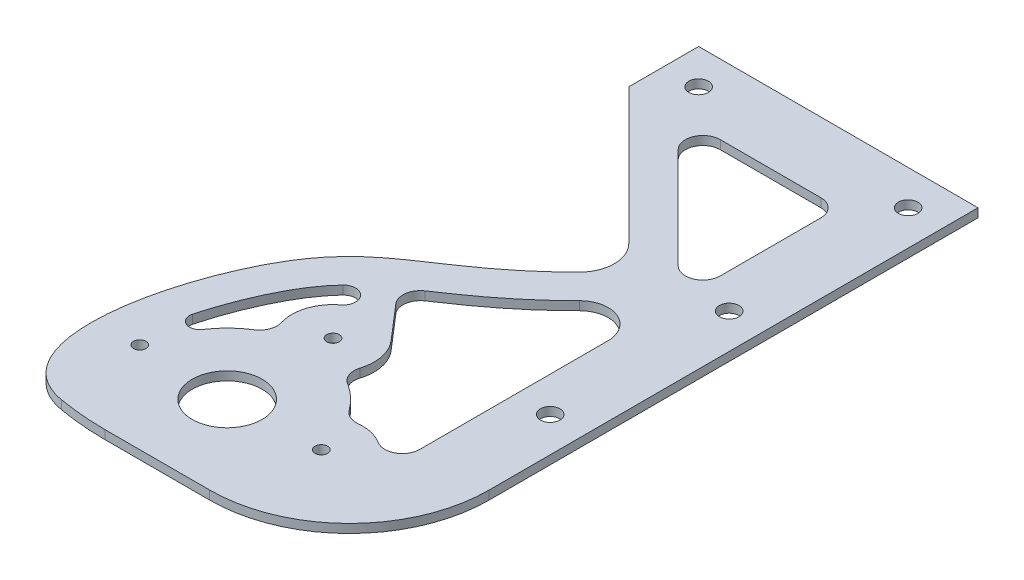
from build123d import *

# Parameters (mm, degrees)
SKETCH1_W               = 254
SKETCH1_H               = 3.175
BASE_FLANGE1_DEPTH      = 114.3
SKETCH6_R               = 12.7
CUT_EXTRUDE1_DEPTH      = 279.550840288
SKETCH7_R               = 2.286
CUT_EXTRUDE2_DEPTH      = 279.550840288
SKETCH9_R               = 3.556
CUT_EXTRUDE4_DEPTH      = 279.550840288
CUT_EXTRUDE6_DEPTH      = 279.550840288
CUT_EXTRUDE9_DEPTH      = 279.550840288
CUT_EXTRUDE9_DEPTH_BACK = 279.550840288
CUT_EXTRUDE10_DEPTH     = 221.768639368
FILLET1_R               = 50.8
CUT_EXTRUDE11_DEPTH     = 170.498049701
FILLET2_DEPTH           = 3.175


with BuildPart() as part:
    # Base-Flange1: sheet metal written as solids
    # Sketch1 → Base-Flange1 (new, symmetric)
    with BuildSketch(Plane.XY):
        with Locations((-127, 1.5875)):
            Rectangle(SKETCH1_W, SKETCH1_H)
    extrude(amount=BASE_FLANGE1_DEPTH, both=True)

    # Sketch6 → Cut-Extrude1 (cut, through all)
    with BuildSketch(Plane.XZ):
        with Locations(Location((-76.2, 82.55, 0), (0, 0, 270))):
            Circle(SKETCH6_R)
    extrude(amount=-CUT_EXTRUDE1_DEPTH, mode=Mode.SUBTRACT)

    # Sketch7 → Cut-Extrude2 (cut, through all)
    with BuildSketch(Plane.XZ):
        with Locations(Location((-43.18, 81.326566426, 0), (0, 0, 270))):
            Circle(SKETCH7_R)
        with Locations(Location((-109.22, 81.326566426, 0), (0, 0, 90))):
            Circle(SKETCH7_R)
        with Locations(Location((-76.2, 44.069, 0), (0, 0, 270))):
            Circle(SKETCH7_R)
    extrude(amount=-CUT_EXTRUDE2_DEPTH, mode=Mode.SUBTRACT)

    # Sketch9 → Cut-Extrude4 (cut, through all)
    with BuildSketch(Plane(origin=(0, 3.175, 0), x_dir=(1, 0, 0), z_dir=(0, 1, 0))):
        with Locations(Location((-12.7, 36.5125, 0), (0, 0, 180))):
            Circle(SKETCH9_R)
        with Locations((-12.7, 101.6)):
            Circle(SKETCH9_R)
        with Locations(Location((-12.7, -28.575, 0), (0, 0, 180))):
            Circle(SKETCH9_R)
        with Locations(Location((-88.9, 101.6, 0), (0, 0, 180))):
            Circle(SKETCH9_R)
    extrude(amount=-CUT_EXTRUDE4_DEPTH, mode=Mode.SUBTRACT)

    # Sketch15 → Cut-Extrude6 (cut, through all)
    with BuildSketch(Plane.XZ):
        Polygon((-101.6, -114.3), (-254, 38.1), (-254, -114.3), align=None)
    extrude(amount=-CUT_EXTRUDE6_DEPTH, mode=Mode.SUBTRACT)

    # Sketch17 → Cut-Extrude9 (cut, two sides: drawn at the far end of the back side and taken through both)
    with BuildSketch(Plane.XZ.offset(-CUT_EXTRUDE9_DEPTH_BACK)):
        with BuildLine():
            Line((-254, 114.3), (-254, 38.1))
            Line((-254, 38.1), (-159.5751337, -56.3248663))
            ThreePointArc((-159.5751337, -56.3248663), (-181.24151223, 52.599374135), (-88.9, 114.3))
            Line((-88.9, 114.3), (-254, 114.3))
        make_face()
    extrude(amount=CUT_EXTRUDE9_DEPTH + CUT_EXTRUDE9_DEPTH_BACK, mode=Mode.SUBTRACT)

    # Sketch18 → Cut-Extrude10 (cut, through all)
    with BuildSketch(Plane.XZ):
        with BuildLine():
            Line((-101.6, -114.3), (-101.6, -88.9))
            Line((-101.6, -88.9), (-52.208591334, -39.508591334))
            ThreePointArc((-52.208591334, -39.508591334), (-48.488847455, -30.528335213), (-52.208591334, -21.548079092))
            add(Edge.make_bspline(
                [(-106.256088924, 112.781538976), (-137.236150888, 107.318918188), (-113.262137977, 5.562411407), (-77.644814764, 3.888144338), (-52.208591334, -21.548079092)],
                knots=[0, 0, 0, 0, 0.537792704, 1, 1, 1, 1], degree=3))
            ThreePointArc((-106.256088924, 112.781538976), (-184.223754204, 44.405731651), (-159.5751337, -56.3248663))
            Line((-159.5751337, -56.3248663), (-101.6, -114.3))
        make_face()
    extrude(amount=-CUT_EXTRUDE10_DEPTH, mode=Mode.SUBTRACT)

    # Fillet1
    fillet1_edges = [part.edges().sort_by_distance(p)[0] for p in [
        (0, 1.5875, 114.3),
    ]]
    fillet(fillet1_edges, radius=FILLET1_R)

    # Sketch19 → Cut-Extrude11 (cut, through all)
    with BuildSketch(Plane(origin=(0, 3.175, 0), x_dir=(1, 0, 0), z_dir=(0, 1, 0))):
        with BuildLine():
            Line((-68.309231637, 88.9), (-31.75, 88.9))
            ThreePointArc((-31.75, 88.9), (-27.259871939, 87.040128061), (-25.4, 82.55))
            Line((-25.4, 82.55), (-25.4, 45.990768363))
            ThreePointArc((-25.4, 45.990768363), (-29.319960204, 40.124133332), (-36.240128061, 41.500640303))
            Line((-36.240128061, 41.500640303), (-72.799359697, 78.059871939))
            ThreePointArc((-72.799359697, 78.059871939), (-74.175866668, 84.980039796), (-68.309231637, 88.9))
        make_face()
        with BuildLine():
            Line((-25.4, 5.183084731), (-25.4, -63.31046263))
            ThreePointArc((-25.4, -63.31046263), (-28.690493445, -68.874806225), (-35.151785714, -68.672398284))
            ThreePointArc((-35.151785714, -68.672398284), (-39.759262533, -66.736201414), (-44.747192121, -66.422737896))
            ThreePointArc((-44.747192121, -66.422737896), (-47.9893887, -65.910636081), (-50.542713816, -63.847963596))
            ThreePointArc((-50.542713816, -63.847963596), (-54.493856691, -59.378771231), (-59.211239435, -55.727537129))
            ThreePointArc((-59.211239435, -55.727537129), (-61.771128872, -52.560544764), (-61.88090181, -48.489817008))
            ThreePointArc((-61.88090181, -48.489817008), (-61.530034533, -41.007577259), (-64.844174471, -34.290174786))
            Line((-64.844174471, -34.290174786), (-75.613232293, -21.784424959))
            ThreePointArc((-75.613232293, -21.784424959), (-77.094715661, -16.793975806), (-74.346704518, -12.372685217))
            add(Edge.make_bspline(
                [(-43.228335213, 12.567822971), (-46.917497652, 8.878660532), (-50.456440758, 5.648495964), (-57.219614246, -0.085464925), (-60.443504999, -2.588941631), (-66.531496779, -7.059997253), (-69.394290936, -9.027669237), (-72.834328708, -11.354789552), (-73.599593433, -11.869910022), (-74.346704518, -12.372685217)],
                knots=[0, 0, 0, 0, 0.0625, 0.0625, 0.125, 0.125, 0.1875, 0.1875, 0.205929014, 0.205929014, 0.205929014, 0.205929014], degree=3))
            ThreePointArc((-43.228335213, 12.567822971), (-31.847005437, 14.831710221), (-25.4, 5.183084731))
        make_face()
        with BuildLine():
            ThreePointArc((-110.360018807, -66.383991242), (-107.147438621, -66.484575814), (-104.030197179, -67.267898542))
            ThreePointArc((-104.030197179, -67.267898542), (-99.340434929, -60.811031043), (-93.188760565, -55.727537129))
            ThreePointArc((-93.188760565, -55.727537129), (-90.628871128, -52.560544764), (-90.51909819, -48.489817008))
            ThreePointArc((-90.51909819, -48.489817008), (-90.463817251, -39.472945885), (-85.244463491, -32.12003033))
            ThreePointArc((-85.244463491, -32.12003033), (-84.622720301, -25.604510261), (-91.167480683, -25.536115004))
            add(Edge.make_bspline(
                [(-91.167480683, -25.536115004), (-92.635934993, -27.101357134), (-94.055170685, -28.817008687), (-96.262497765, -31.913028022), (-97.045227937, -33.09572145), (-98.628898545, -35.6878173), (-99.428995475, -37.095537018), (-101.805342608, -41.586869819), (-103.35622482, -44.937897773), (-106.205005263, -52.031513868), (-107.504026121, -55.775168297), (-109.265538459, -61.831529556), (-109.854670713, -64.117538163), (-110.360018807, -66.383991242)],
                knots=[0.380798959, 0.380798959, 0.380798959, 0.380798959, 0.4375, 0.4375, 0.46875, 0.46875, 0.5, 0.5, 0.5625, 0.5625, 0.625, 0.625, 0.662483442, 0.662483442, 0.662483442, 0.662483442], degree=3))
        make_face()
    extrude(amount=-CUT_EXTRUDE11_DEPTH, mode=Mode.SUBTRACT)

    # Fillet2: read off the stored shape, not the designer's step
    # Fillet2 outline → Fillet2 (add)
    with BuildSketch(Plane(origin=(0, 0, 0), x_dir=(1.0, 1.1573850035061633e-12, 0), z_dir=(-1.1573850035061633e-12, 1.0, 0))):
        with BuildLine():
            ThreePointArc((-104.030197179, -67.267898542), (-103.374185767, -66.129703781), (-102.671651197, -65.019621142))
            add(Edge.make_bspline(
                [(-102.671651197, -65.019621142), (-103.429510547, -66.164022442), (-104.780608937, -66.91555764), (-106.42610863, -66.603307038)],
                knots=[0, 0, 0, 0, 0.430480656, 0.430480656, 0.430480656, 0.430480656], degree=3, weights=[1, 0.75936345, 0.62231628, 0.58885849]))
            ThreePointArc((-106.42610863, -66.603307038), (-105.214346034, -66.885827792), (-104.030197179, -67.267898542))
        make_face()
        with BuildLine():
            ThreePointArc((-110.360018807, -66.383991242), (-108.385824678, -66.363801056), (-106.42610863, -66.603307038))
            add(Edge.make_bspline(
                [(-106.42610863, -66.603307038), (-108.913766663, -66.131248173), (-109.817041103, -63.994539841), (-109.296016182, -62.039816736)],
                knots=[0.430480656, 0.430480656, 0.430480656, 0.430480656, 1, 1, 1, 1], degree=3, weights=[0.58885849, 0.544594344, 0.681641514, 1]))
            add(Edge.make_bspline(
                [(-109.296016182, -62.039816736), (-109.682496439, -63.489770196), (-110.038242372, -64.940845021), (-110.360018807, -66.383991242)],
                knots=[0.638616154, 0.638616154, 0.638616154, 0.638616154, 0.662483442, 0.662483442, 0.662483442, 0.662483442], degree=3))
        make_face()
    extrude(amount=FILLET2_DEPTH)


solid = part.part
